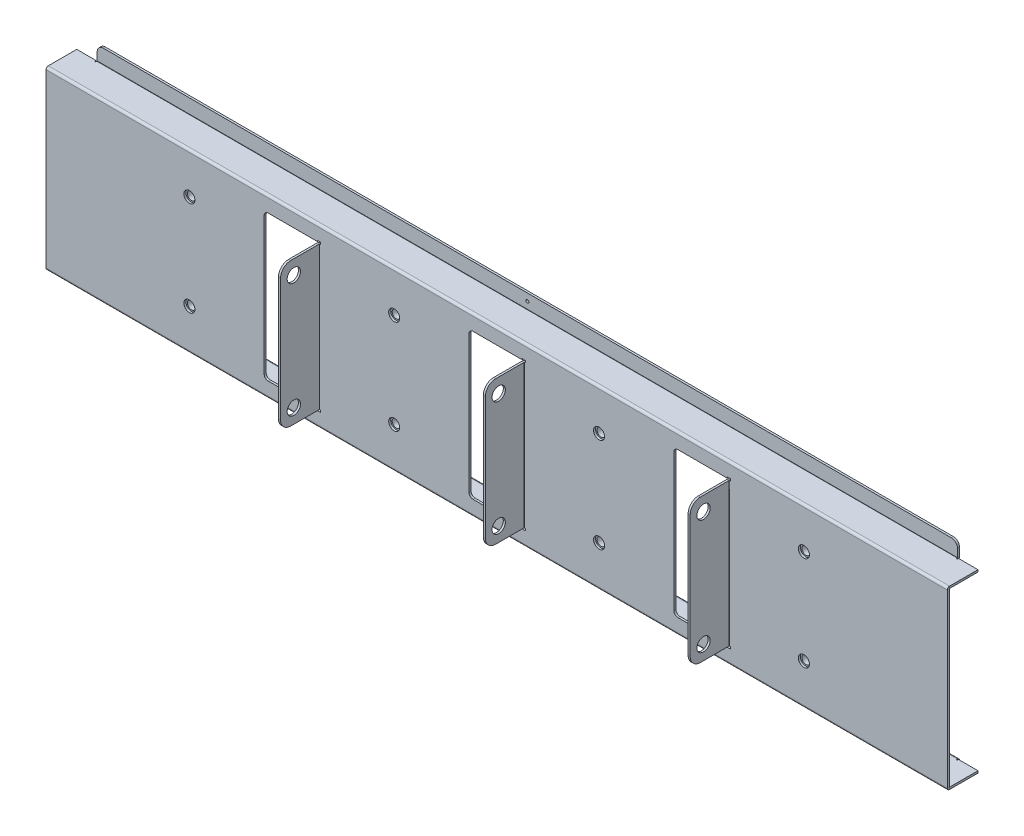
from build123d import *

# Parameters (mm, degrees)
SKETCH_1_W                          = 440
SKETCH_1_H                          = 86
SM_BASE_FLANGE_1_DEPTH              = 1
SM_EDGE_FLANGE_1_STRIP_W            = 4.2
SM_EDGE_FLANGE_1_STRIP_H            = 1
SM_EDGE_FLANGE_1_STRIP_CUT_DEPTH    = 440
SM_EDGE_FLANGE_1_STRIP_2_W          = 4.2
SM_EDGE_FLANGE_1_STRIP_2_H          = 1
SM_EDGE_FLANGE_1_STRIP_CUT_2_DEPTH  = 440
SM_EDGE_FLANGE_1_DEPTH              = 440
SM_EDGE_FLANGE_1_BEND_DEPTH         = 440
SM_EDGE_FLANGE_2_STRIP_W            = 5.2
SM_EDGE_FLANGE_2_STRIP_H            = 1
SM_EDGE_FLANGE_2_STRIP_CUT_DEPTH    = 420
SM_EDGE_FLANGE_2_RELIEF_W           = 5.7
SM_EDGE_FLANGE_2_RELIEF_H           = 0.5
SM_EDGE_FLANGE_2_RELIEF_CUT_DEPTH   = 1
SM_EDGE_FLANGE_2_STRIP_2_W          = 5.2
SM_EDGE_FLANGE_2_STRIP_2_H          = 1
SM_EDGE_FLANGE_2_STRIP_CUT_2_DEPTH  = 420
SM_EDGE_FLANGE_2_RELIEF_2_W         = 5.7
SM_EDGE_FLANGE_2_RELIEF_2_H         = 0.5
SM_EDGE_FLANGE_2_RELIEF_CUT_2_DEPTH = 1
SM_EDGE_FLANGE_2_DEPTH              = 420
SM_EDGE_FLANGE_2_BEND_DEPTH         = 420
SKETCH_18_W                         = 26
SKETCH_18_H                         = 71
CUT_EXTRUDE_1_DEPTH                 = 10
SM_START                            = -36
SM_EDGE_FLANGE_3_DEPTH              = 72
SM_EDGE_FLANGE_3_2_DEPTH            = 0.5
SM_START_2                          = 35.5
SM_EDGE_FLANGE_3_3_DEPTH            = 0.5
SM_START_3                          = -35.5
SM_EDGE_FLANGE_3_4_DEPTH            = 71
SKETCH_22_R                         = 3.25
CUT_EXTRUDE_2_DEPTH                 = 10
FILLET_1_R                          = 5
PATTERN_LINEAR_4_COUNT              = 2
PATTERN_LINEAR_4_PITCH              = 100
FILLET_1_OF_PATTERN_LINEAR_4_R      = 5
PATTERN_LINEAR_5_COUNT              = 2
PATTERN_LINEAR_5_PITCH              = 100
FILLET_1_OF_PATTERN_LINEAR_5_R      = 5
FILLET_2_R                          = 3
FILLET_3_R                          = 2
SKETCH_23_R                         = 2.7
CUT_EXTRUDE_3_DEPTH                 = 10
SKETCH_24_R                         = 4
SKETCH_24_R_2                       = 2
EXTRUDE_1_DEPTH                     = 3
EXTRUDE_1_2_DEPTH                   = 3
EXTRUDE_1_3_DEPTH                   = 3
EXTRUDE_1_4_DEPTH                   = 3
EXTRUDE_1_5_DEPTH                   = 3
EXTRUDE_1_6_DEPTH                   = 3
EXTRUDE_1_7_DEPTH                   = 3
EXTRUDE_1_8_DEPTH                   = 3
SKETCH_25_R                         = 0.75
CUT_EXTRUDE_4_DEPTH                 = 10
MOVE_START                          = -87.5
MOVE_FACE_1_DEPTH                   = 201.1
MOVE_FACE_1_2_OUTLINE_W             = 0.5
MOVE_FACE_1_2_OUTLINE_H             = 1
MOVE_FACE_1_2_DEPTH                 = 1.6
MOVE_START_2                        = 12.5
MOVE_FACE_1_3_OUTLINE_W             = 0.5
MOVE_FACE_1_3_OUTLINE_H             = 1
MOVE_FACE_1_3_DEPTH                 = 1.6
MOVE_START_3                        = 112.5
MOVE_FACE_1_4_OUTLINE_W             = 0.5
MOVE_FACE_1_4_OUTLINE_H             = 1
MOVE_FACE_1_4_DEPTH                 = 1.6
MOVE_FACE_2_DEPTH                   = 201.1
MOVE_FACE_2_2_OUTLINE_W             = 0.5
MOVE_FACE_2_2_OUTLINE_H             = 1
MOVE_FACE_2_2_DEPTH                 = 1.6
MOVE_FACE_2_3_OUTLINE_W             = 0.5
MOVE_FACE_2_3_OUTLINE_H             = 1
MOVE_FACE_2_3_DEPTH                 = 1.6
MOVE_FACE_2_4_OUTLINE_W             = 0.5
MOVE_FACE_2_4_OUTLINE_H             = 1
MOVE_FACE_2_4_DEPTH                 = 1.6


# Read off the part's stored shape, not the designer's step: 边线-法兰3, 移动面1, 移动面2
# Sheet-metal steps are written as plain solids
with BuildPart() as part:
    # Sketch 1 → 基体-法兰1 (new body)
    with BuildSketch(Plane.XY):
        Rectangle(SKETCH_1_W, SKETCH_1_H)
    extrude(amount=-SM_BASE_FLANGE_1_DEPTH)

    # 边线-法兰1 strip (across the edge) → 边线-法兰1 strip cut (cut)
    with BuildSketch(Plane(origin=(-220, 43, -1), x_dir=(0, -1, 0), z_dir=(1, 0, 0))):
        with Locations((-1, -0.5)):
            Rectangle(SM_EDGE_FLANGE_1_STRIP_W, SM_EDGE_FLANGE_1_STRIP_H)
    extrude(amount=SM_EDGE_FLANGE_1_STRIP_CUT_DEPTH, mode=Mode.SUBTRACT)

    # 边线-法兰1 strip 2 (across the edge) → 边线-法兰1 strip cut 2 (cut)
    with BuildSketch(Plane(origin=(220, -43, -1), x_dir=(0, 1, 0), z_dir=(-1, 0, 0))):
        with Locations((-1, -0.5)):
            Rectangle(SM_EDGE_FLANGE_1_STRIP_2_W, SM_EDGE_FLANGE_1_STRIP_2_H)
    extrude(amount=SM_EDGE_FLANGE_1_STRIP_CUT_2_DEPTH, mode=Mode.SUBTRACT)

    # 边线-法兰1 section (across the edge) → 边线-法兰1 (add)
    with BuildSketch(Plane(origin=(-220, 43, -1), x_dir=(0, -1, 0), z_dir=(1, 0, 0))):
        with BuildLine():
            Line((0, 0.1), (0, 14))
            Line((0, 14), (1, 14))
            Line((1, 14), (1, 0.1))
            ThreePointArc((1, 0.1), (1.029289322, 0.029289322), (1.1, 0))
            Line((1.1, 0), (1.1, -1))
            ThreePointArc((1.1, -1), (0.322182541, -0.677817459), (0, 0.1))
        make_face()
    extrude(amount=SM_EDGE_FLANGE_1_DEPTH)

    # 边线-法兰1 section 2 (across the edge) → 边线-法兰1 bend (add)
    with BuildSketch(Plane(origin=(220, -43, -1), x_dir=(0, 1, 0), z_dir=(-1, 0, 0))):
        with BuildLine():
            Line((0, 0.1), (0, 14))
            Line((0, 14), (1, 14))
            Line((1, 14), (1, 0.1))
            ThreePointArc((1, 0.1), (1.029289322, 0.029289322), (1.1, 0))
            Line((1.1, 0), (1.1, -1))
            ThreePointArc((1.1, -1), (0.322182541, -0.677817459), (0, 0.1))
        make_face()
    extrude(amount=SM_EDGE_FLANGE_1_BEND_DEPTH)

    # 边线-法兰2 strip (across the edge) → 边线-法兰2 strip cut (cut)
    with BuildSketch(Plane(origin=(210, 43, -16), x_dir=(0, 0, 1), z_dir=(-1, 0, 0))):
        with Locations((-1.5, -0.5)):
            Rectangle(SM_EDGE_FLANGE_2_STRIP_W, SM_EDGE_FLANGE_2_STRIP_H)
    extrude(amount=SM_EDGE_FLANGE_2_STRIP_CUT_DEPTH, mode=Mode.SUBTRACT)

    # 边线-法兰2 relief (on the sheet) → 边线-法兰2 relief cut (cut)
    with BuildSketch(Plane(origin=(210, 43, -14.9), x_dir=(0, 0, 1), z_dir=(0, 1, 0))):
        with Locations((-2.35, 0.25)):
            Rectangle(SM_EDGE_FLANGE_2_RELIEF_W, SM_EDGE_FLANGE_2_RELIEF_H)
        with Locations((-2.35, -420.25)):
            Rectangle(SM_EDGE_FLANGE_2_RELIEF_W, SM_EDGE_FLANGE_2_RELIEF_H)
    extrude(amount=-SM_EDGE_FLANGE_2_RELIEF_CUT_DEPTH, mode=Mode.SUBTRACT)

    # 边线-法兰2 strip 2 (across the edge) → 边线-法兰2 strip cut 2 (cut)
    with BuildSketch(Plane(origin=(-210, -43, -16), x_dir=(0, 0, 1), z_dir=(1, 0, 0))):
        with Locations((-1.5, -0.5)):
            Rectangle(SM_EDGE_FLANGE_2_STRIP_2_W, SM_EDGE_FLANGE_2_STRIP_2_H)
    extrude(amount=SM_EDGE_FLANGE_2_STRIP_CUT_2_DEPTH, mode=Mode.SUBTRACT)

    # 边线-法兰2 relief 2 (on the sheet) → 边线-法兰2 relief cut 2 (cut)
    with BuildSketch(Plane(origin=(-210, -43, -14.9), x_dir=(0, 0, 1), z_dir=(0, -1, 0))):
        with Locations((-2.35, 0.25)):
            Rectangle(SM_EDGE_FLANGE_2_RELIEF_2_W, SM_EDGE_FLANGE_2_RELIEF_2_H)
        with Locations((-2.35, -420.25)):
            Rectangle(SM_EDGE_FLANGE_2_RELIEF_2_W, SM_EDGE_FLANGE_2_RELIEF_2_H)
    extrude(amount=-SM_EDGE_FLANGE_2_RELIEF_CUT_2_DEPTH, mode=Mode.SUBTRACT)

    # 边线-法兰2 section (across the edge) → 边线-法兰2 (add)
    with BuildSketch(Plane(origin=(210, 43, -16), x_dir=(0, 0, 1), z_dir=(-1, 0, 0))):
        with BuildLine():
            Line((0, 0.1), (0, 7))
            Line((0, 7), (1, 7))
            Line((1, 7), (1, 0.1))
            ThreePointArc((1, 0.1), (1.029289322, 0.029289322), (1.1, 0))
            Line((1.1, 0), (1.1, -1))
            ThreePointArc((1.1, -1), (0.322182541, -0.677817459), (0, 0.1))
        make_face()
    extrude(amount=SM_EDGE_FLANGE_2_DEPTH)

    # 边线-法兰2 section 2 (across the edge) → 边线-法兰2 bend (add)
    with BuildSketch(Plane(origin=(-210, -43, -16), x_dir=(0, 0, 1), z_dir=(1, 0, 0))):
        with BuildLine():
            Line((0, 0.1), (0, 7))
            Line((0, 7), (1, 7))
            Line((1, 7), (1, 0.1))
            ThreePointArc((1, 0.1), (1.029289322, 0.029289322), (1.1, 0))
            Line((1.1, 0), (1.1, -1))
            ThreePointArc((1.1, -1), (0.322182541, -0.677817459), (0, 0.1))
        make_face()
    extrude(amount=SM_EDGE_FLANGE_2_BEND_DEPTH)

    # 草图18 → 切除-拉伸1 (cut)
    with BuildSketch(Plane.XY):
        with Locations((-0.5, 0)):
            Rectangle(SKETCH_18_W, SKETCH_18_H)
    cut_extrude_1 = extrude(amount=-CUT_EXTRUDE_1_DEPTH, mode=Mode.SUBTRACT)

    # 边线-法兰3 outline → 边线-法兰3 (cut)
    with BuildSketch(Plane(origin=(0, 0, 0), x_dir=(1, 0, 0), z_dir=(0, 1, 0)).offset(SM_START)):
        with BuildLine():
            ThreePointArc((12.504554885, 0), (12.858380152, 0.71240384), (13.6, 1))
            Line((13.6, 1), (12.5, 1))
            Line((12.5, 1), (12.5, 0))
            Line((12.5, 0), (12.504554885, 0))
        make_face()
    sm_edge_flange_3 = extrude(amount=SM_EDGE_FLANGE_3_DEPTH, mode=Mode.SUBTRACT)

    # Sm Edge Flange 3 2 outline → Sm Edge Flange 3 2 (cut)
    with BuildSketch(Plane(origin=(0, 0, 0), x_dir=(1, 0, 0), z_dir=(0, 1, 0)).offset(SM_START)):
        with BuildLine():
            Line((14.1, 0), (14.1, 1))
            Line((14.1, 1), (13.6, 1))
            ThreePointArc((13.6, 1), (12.858380152, 0.71240384), (12.504554885, 0))
            Line((12.504554885, 0), (14.1, 0))
        make_face()
    sm_edge_flange_3_2 = extrude(amount=SM_EDGE_FLANGE_3_2_DEPTH, mode=Mode.SUBTRACT)

    # Sm Edge Flange 3 3 outline → Sm Edge Flange 3 3 (cut)
    with BuildSketch(Plane(origin=(0, 0, 0), x_dir=(1, 0, 0), z_dir=(0, 1, 0)).offset(SM_START_2)):
        with BuildLine():
            Line((14.1, 0), (14.1, 1))
            Line((14.1, 1), (13.6, 1))
            ThreePointArc((13.6, 1), (12.858380152, 0.71240384), (12.504554885, 0))
            Line((12.504554885, 0), (14.1, 0))
        make_face()
    sm_edge_flange_3_3 = extrude(amount=SM_EDGE_FLANGE_3_3_DEPTH, mode=Mode.SUBTRACT)

    # Sm Edge Flange 3 4 outline → Sm Edge Flange 3 4 (add)
    with BuildSketch(Plane(origin=(0, 0, 0), x_dir=(1, 0, 0), z_dir=(0, 1, 0)).offset(SM_START_3)):
        with BuildLine():
            ThreePointArc((13.5, -0.1), (13.529289322, -0.029289322), (13.6, 0))
            Line((13.6, 0), (12.504554885, 0))
            ThreePointArc((12.504554885, 0), (12.501139311, -0.049948159), (12.5, -0.1))
            Line((12.5, -0.1), (12.5, -19))
            Line((12.5, -19), (13.5, -19))
            Line((13.5, -19), (13.5, -0.1))
        make_face()
    sm_edge_flange_3_4 = extrude(amount=SM_EDGE_FLANGE_3_4_DEPTH)

    # 草图22 → 切除-拉伸2 (cut)
    with BuildSketch(Plane.ZY.offset(-12.5)):
        with Locations((12.5, 28)):
            Circle(SKETCH_22_R)
        with Locations((12.5, -28)):
            Circle(SKETCH_22_R)
    cut_extrude_2 = extrude(amount=-CUT_EXTRUDE_2_DEPTH, mode=Mode.SUBTRACT)

    # 圆角1
    fillet_1_edges = [part.edges().sort_by_distance(p)[0] for p in [
        (13, 35.5, 19),
        (13, -35.5, 19),
    ]]
    fillet(fillet_1_edges, radius=FILLET_1_R)

    # 阵列(线性)4: 切除-拉伸1, 边线-法兰3, Sm Edge Flange 3 2, Sm Edge Flange 3 3, Sm Edge Flange 3 4, 切除-拉伸2 ×2
    with Locations(*[(i * PATTERN_LINEAR_4_PITCH, 0, 0) for i in range(1, PATTERN_LINEAR_4_COUNT)]):
        add(cut_extrude_1, mode=Mode.SUBTRACT)
        add(sm_edge_flange_3, mode=Mode.SUBTRACT)
        add(sm_edge_flange_3_2, mode=Mode.SUBTRACT)
        add(sm_edge_flange_3_3, mode=Mode.SUBTRACT)
        add(sm_edge_flange_3_4)
        add(cut_extrude_2, mode=Mode.SUBTRACT)

    # 圆角1 of 阵列(线性)4
    fillet_1_of_pattern_linear_4_edges = [part.edges().sort_by_distance(p)[0] for p in [
        (113, 35.5, 19),
        (113, -35.5, 19),
    ]]
    fillet(fillet_1_of_pattern_linear_4_edges, radius=FILLET_1_OF_PATTERN_LINEAR_4_R)

    # 阵列(线性)5: 切除-拉伸1, 边线-法兰3, Sm Edge Flange 3 2, Sm Edge Flange 3 3, Sm Edge Flange 3 4, 切除-拉伸2 ×2
    with Locations(*[(-i * PATTERN_LINEAR_5_PITCH, 0, 0) for i in range(1, PATTERN_LINEAR_5_COUNT)]):
        add(cut_extrude_1, mode=Mode.SUBTRACT)
        add(sm_edge_flange_3, mode=Mode.SUBTRACT)
        add(sm_edge_flange_3_2, mode=Mode.SUBTRACT)
        add(sm_edge_flange_3_3, mode=Mode.SUBTRACT)
        add(sm_edge_flange_3_4)
        add(cut_extrude_2, mode=Mode.SUBTRACT)

    # 圆角1 of 阵列(线性)5
    fillet_1_of_pattern_linear_5_edges = [part.edges().sort_by_distance(p)[0] for p in [
        (-87, 35.5, 19),
        (-87, -35.5, 19),
    ]]
    fillet(fillet_1_of_pattern_linear_5_edges, radius=FILLET_1_OF_PATTERN_LINEAR_5_R)

    # 圆角2
    fillet_2_edges = [part.edges().sort_by_distance(p)[0] for p in [
        (210, 50, -15.5),
        (-210, 50, -15.5),
        (-210, -50, -15.5),
        (210, -50, -15.5),
    ]]
    fillet(fillet_2_edges, radius=FILLET_2_R)

    # 圆角3
    fillet_3_edges = [part.edges().sort_by_distance(p)[0] for p in [
        (-13.5, -35.5, -0.5),
        (-13.5, 35.5, -0.5),
        (86.5, -35.5, -0.5),
        (86.5, 35.5, -0.5),
        (-113.5, -35.5, -0.5),
        (-113.5, 35.5, -0.5),
    ]]
    fillet(fillet_3_edges, radius=FILLET_3_R)

    # 草图23 → 切除-拉伸3 (cut)
    with BuildSketch(Plane.XY):
        with Locations((-150, 23.1)):
            Circle(SKETCH_23_R)
        with Locations((-150, -23.1)):
            Circle(SKETCH_23_R)
        with Locations((-50, 23.1)):
            Circle(SKETCH_23_R)
        with Locations((-50, -23.1)):
            Circle(SKETCH_23_R)
        with Locations((50, 23.1)):
            Circle(SKETCH_23_R)
        with Locations((50, -23.1)):
            Circle(SKETCH_23_R)
        with Locations((150, 23.1)):
            Circle(SKETCH_23_R)
        with Locations((150, -23.1)):
            Circle(SKETCH_23_R)
    extrude(amount=-CUT_EXTRUDE_3_DEPTH, mode=Mode.SUBTRACT)

    # 草图25 → 切除-拉伸4 (cut)
    with BuildSketch(Plane.XY.offset(-15)):
        with Locations((0, -46.5)):
            Circle(SKETCH_25_R)
        with Locations((0, 46.5)):
            Circle(SKETCH_25_R)
    extrude(amount=-CUT_EXTRUDE_4_DEPTH, mode=Mode.SUBTRACT)

    # Move Face 1 outline → Move Face 1 (cut)
    with BuildSketch(Plane.YZ.offset(MOVE_START)):
        with BuildLine():
            Line((35, 14), (35, 0))
            Line((35, 0), (35.5, 0))
            Line((35.5, 0), (35.5, 14))
            ThreePointArc((35.5, 14), (34.035533906, 17.535533906), (30.5, 19))
            Line((30.5, 19), (30, 19))
            ThreePointArc((30, 19), (33.535533906, 17.535533906), (35, 14))
        make_face()
    extrude(amount=MOVE_FACE_1_DEPTH, mode=Mode.SUBTRACT)

    # Move Face 1 2 outline → Move Face 1 2 (cut)
    with BuildSketch(Plane.YZ.offset(MOVE_START)):
        with Locations((35.25, -0.5)):
            Rectangle(MOVE_FACE_1_2_OUTLINE_W, MOVE_FACE_1_2_OUTLINE_H)
    extrude(amount=MOVE_FACE_1_2_DEPTH, mode=Mode.SUBTRACT)

    # Move Face 1 3 outline → Move Face 1 3 (cut)
    with BuildSketch(Plane.YZ.offset(MOVE_START_2)):
        with Locations((35.25, -0.5)):
            Rectangle(MOVE_FACE_1_3_OUTLINE_W, MOVE_FACE_1_3_OUTLINE_H)
    extrude(amount=MOVE_FACE_1_3_DEPTH, mode=Mode.SUBTRACT)

    # Move Face 1 4 outline → Move Face 1 4 (cut)
    with BuildSketch(Plane.YZ.offset(MOVE_START_3)):
        with Locations((35.25, -0.5)):
            Rectangle(MOVE_FACE_1_4_OUTLINE_W, MOVE_FACE_1_4_OUTLINE_H)
    extrude(amount=MOVE_FACE_1_4_DEPTH, mode=Mode.SUBTRACT)

    # Move Face 2 outline → Move Face 2 (cut)
    with BuildSketch(Plane.YZ.offset(MOVE_START)):
        with BuildLine():
            Line((-35.5, 0), (-35, 0))
            Line((-35, 0), (-35, 14))
            ThreePointArc((-35, 14), (-33.535533906, 17.535533906), (-30, 19))
            Line((-30, 19), (-30.5, 19))
            ThreePointArc((-30.5, 19), (-34.035533906, 17.535533906), (-35.5, 14))
            Line((-35.5, 14), (-35.5, 0))
        make_face()
    extrude(amount=MOVE_FACE_2_DEPTH, mode=Mode.SUBTRACT)

    # Move Face 2 2 outline → Move Face 2 2 (cut)
    with BuildSketch(Plane.YZ.offset(MOVE_START)):
        with Locations((-35.25, -0.5)):
            Rectangle(MOVE_FACE_2_2_OUTLINE_W, MOVE_FACE_2_2_OUTLINE_H)
    extrude(amount=MOVE_FACE_2_2_DEPTH, mode=Mode.SUBTRACT)

    # Move Face 2 3 outline → Move Face 2 3 (cut)
    with BuildSketch(Plane.YZ.offset(MOVE_START_2)):
        with Locations((-35.25, -0.5)):
            Rectangle(MOVE_FACE_2_3_OUTLINE_W, MOVE_FACE_2_3_OUTLINE_H)
    extrude(amount=MOVE_FACE_2_3_DEPTH, mode=Mode.SUBTRACT)

    # Move Face 2 4 outline → Move Face 2 4 (cut)
    with BuildSketch(Plane.YZ.offset(MOVE_START_3)):
        with Locations((-35.25, -0.5)):
            Rectangle(MOVE_FACE_2_4_OUTLINE_W, MOVE_FACE_2_4_OUTLINE_H)
    extrude(amount=MOVE_FACE_2_4_DEPTH, mode=Mode.SUBTRACT)


with BuildPart() as body_2:
    # 草图24 → 凸台-拉伸1 (new body)
    with BuildSketch(Plane(origin=(0, 0, -1), x_dir=(-1, 0, 0), z_dir=(0, 0, -1))):
        with Locations((-150, 23.1)):
            Circle(SKETCH_24_R)
        with Locations((-150, 23.1)):
            Circle(SKETCH_24_R_2, mode=Mode.SUBTRACT)
    extrude(amount=EXTRUDE_1_DEPTH)


with BuildPart() as body_3:
    # 草图24 → Extrude 1 2 (new body)
    with BuildSketch(Plane(origin=(0, 0, -1), x_dir=(-1, 0, 0), z_dir=(0, 0, -1))):
        with Locations(Location((-150, -23.1, 0), (0, 0, 180))):
            Circle(SKETCH_24_R)
        with Locations(Location((-150, -23.1, 0), (0, 0, 180))):
            Circle(SKETCH_24_R_2, mode=Mode.SUBTRACT)
    extrude(amount=EXTRUDE_1_2_DEPTH)


with BuildPart() as body_4:
    # 草图24 → Extrude 1 3 (new body)
    with BuildSketch(Plane(origin=(0, 0, -1), x_dir=(-1, 0, 0), z_dir=(0, 0, -1))):
        with Locations((-50, 23.1)):
            Circle(SKETCH_24_R)
        with Locations((-50, 23.1)):
            Circle(SKETCH_24_R_2, mode=Mode.SUBTRACT)
    extrude(amount=EXTRUDE_1_3_DEPTH)


with BuildPart() as body_5:
    # 草图24 → Extrude 1 4 (new body)
    with BuildSketch(Plane(origin=(0, 0, -1), x_dir=(-1, 0, 0), z_dir=(0, 0, -1))):
        with Locations(Location((-50, -23.1, 0), (0, 0, 180))):
            Circle(SKETCH_24_R)
        with Locations(Location((-50, -23.1, 0), (0, 0, 180))):
            Circle(SKETCH_24_R_2, mode=Mode.SUBTRACT)
    extrude(amount=EXTRUDE_1_4_DEPTH)


with BuildPart() as body_6:
    # 草图24 → Extrude 1 5 (new body)
    with BuildSketch(Plane(origin=(0, 0, -1), x_dir=(-1, 0, 0), z_dir=(0, 0, -1))):
        with Locations((50, 23.1)):
            Circle(SKETCH_24_R)
        with Locations((50, 23.1)):
            Circle(SKETCH_24_R_2, mode=Mode.SUBTRACT)
    extrude(amount=EXTRUDE_1_5_DEPTH)


with BuildPart() as body_7:
    # 草图24 → Extrude 1 6 (new body)
    with BuildSketch(Plane(origin=(0, 0, -1), x_dir=(-1, 0, 0), z_dir=(0, 0, -1))):
        with Locations(Location((50, -23.1, 0), (0, 0, 180))):
            Circle(SKETCH_24_R)
        with Locations(Location((50, -23.1, 0), (0, 0, 180))):
            Circle(SKETCH_24_R_2, mode=Mode.SUBTRACT)
    extrude(amount=EXTRUDE_1_6_DEPTH)


with BuildPart() as body_8:
    # 草图24 → Extrude 1 7 (new body)
    with BuildSketch(Plane(origin=(0, 0, -1), x_dir=(-1, 0, 0), z_dir=(0, 0, -1))):
        with Locations((150, 23.1)):
            Circle(SKETCH_24_R)
        with Locations((150, 23.1)):
            Circle(SKETCH_24_R_2, mode=Mode.SUBTRACT)
    extrude(amount=EXTRUDE_1_7_DEPTH)


with BuildPart() as body_9:
    # 草图24 → Extrude 1 8 (new body)
    with BuildSketch(Plane(origin=(0, 0, -1), x_dir=(-1, 0, 0), z_dir=(0, 0, -1))):
        with Locations(Location((150, -23.1, 0), (0, 0, 180))):
            Circle(SKETCH_24_R)
        with Locations(Location((150, -23.1, 0), (0, 0, 180))):
            Circle(SKETCH_24_R_2, mode=Mode.SUBTRACT)
    extrude(amount=EXTRUDE_1_8_DEPTH)


solid = Compound([part.part, body_2.part, body_3.part, body_4.part, body_5.part, body_6.part, body_7.part, body_8.part, body_9.part])
